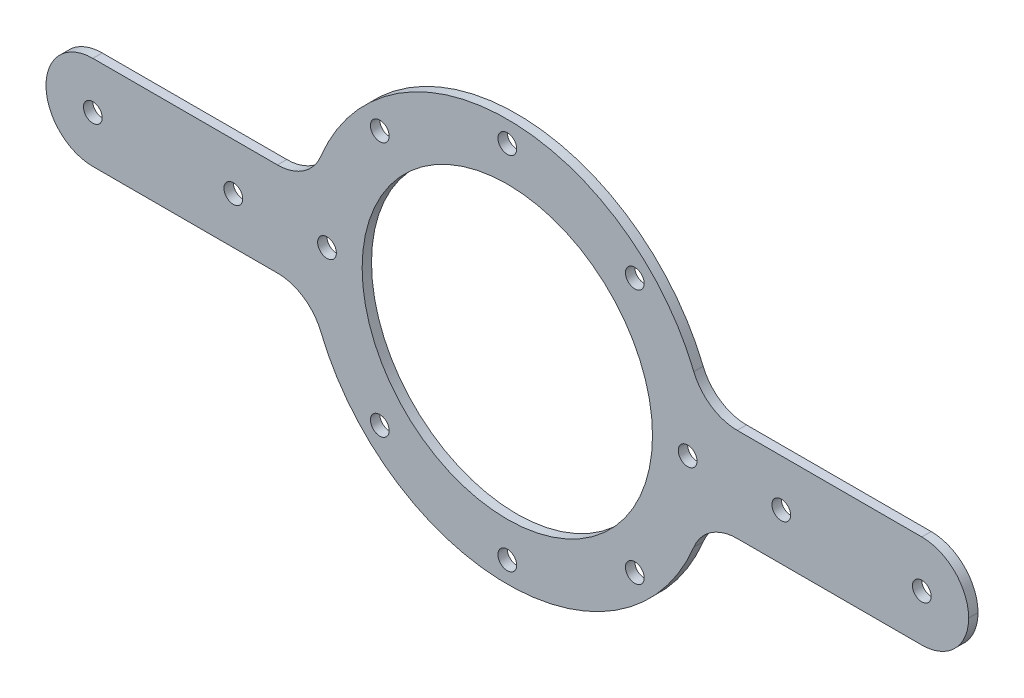
from build123d import *

# Parameters (mm, degrees)
SKETCH1_R           = 31
SKETCH1_R_2         = 2
BOSS_EXTRUDE1_DEPTH = 1
FILLET1_R           = 10


with BuildPart() as part:
    # Sketch1 → Boss-Extrude1 (new, symmetric)
    with BuildSketch(Plane.XY):
        with BuildLine():
            Line((-41.821047333, 10), (-98.5, 10))
            Line((-98.5, 10), (-98.5, -10))
            Line((-98.5, -10), (-41.821047333, -10))
            ThreePointArc((-41.821047333, -10), (0, -43), (41.821047333, -10))
            Line((41.821047333, -10), (98.5, -10))
            Line((98.5, -10), (98.5, 10))
            Line((98.5, 10), (41.821047333, 10))
            ThreePointArc((41.821047333, 10), (0, 43), (-41.821047333, 10))
        make_face()
        Circle(SKETCH1_R, mode=Mode.SUBTRACT)
        with Locations((0, 38.5)):
            Circle(SKETCH1_R_2, mode=Mode.SUBTRACT)
        with Locations((27.223611076, 27.223611076)):
            Circle(SKETCH1_R_2, mode=Mode.SUBTRACT)
        with Locations((38.5, 0)):
            Circle(SKETCH1_R_2, mode=Mode.SUBTRACT)
        with Locations((27.223611076, -27.223611076)):
            Circle(SKETCH1_R_2, mode=Mode.SUBTRACT)
        with Locations((0, -38.5)):
            Circle(SKETCH1_R_2, mode=Mode.SUBTRACT)
        with Locations((-27.223611076, -27.223611076)):
            Circle(SKETCH1_R_2, mode=Mode.SUBTRACT)
        with Locations((-38.5, 0)):
            Circle(SKETCH1_R_2, mode=Mode.SUBTRACT)
        with Locations((-27.223611076, 27.223611076)):
            Circle(SKETCH1_R_2, mode=Mode.SUBTRACT)
        with Locations((-58.5, 0)):
            Circle(SKETCH1_R_2, mode=Mode.SUBTRACT)
        with Locations((-88.5, 0)):
            Circle(SKETCH1_R_2, mode=Mode.SUBTRACT)
        with Locations((58.5, 0)):
            Circle(SKETCH1_R_2, mode=Mode.SUBTRACT)
        with Locations((88.5, 0)):
            Circle(SKETCH1_R_2, mode=Mode.SUBTRACT)
    extrude(amount=BOSS_EXTRUDE1_DEPTH, both=True)

    # Fillet1
    fillet1_edges = [part.edges().sort_by_distance(p)[0] for p in [
        (98.5, -10, 0),
        (98.5, 10, 0),
        (41.821047333, -10, 0),
        (41.821047333, 10, 0),
        (-41.821047333, -10, 0),
        (-98.5, -10, 0),
        (-98.5, 10, 0),
        (-41.821047333, 10, 0),
    ]]
    fillet(fillet1_edges, radius=FILLET1_R - 0.0001)  # a hair under: the kernel refuses the full size


solid = part.part
